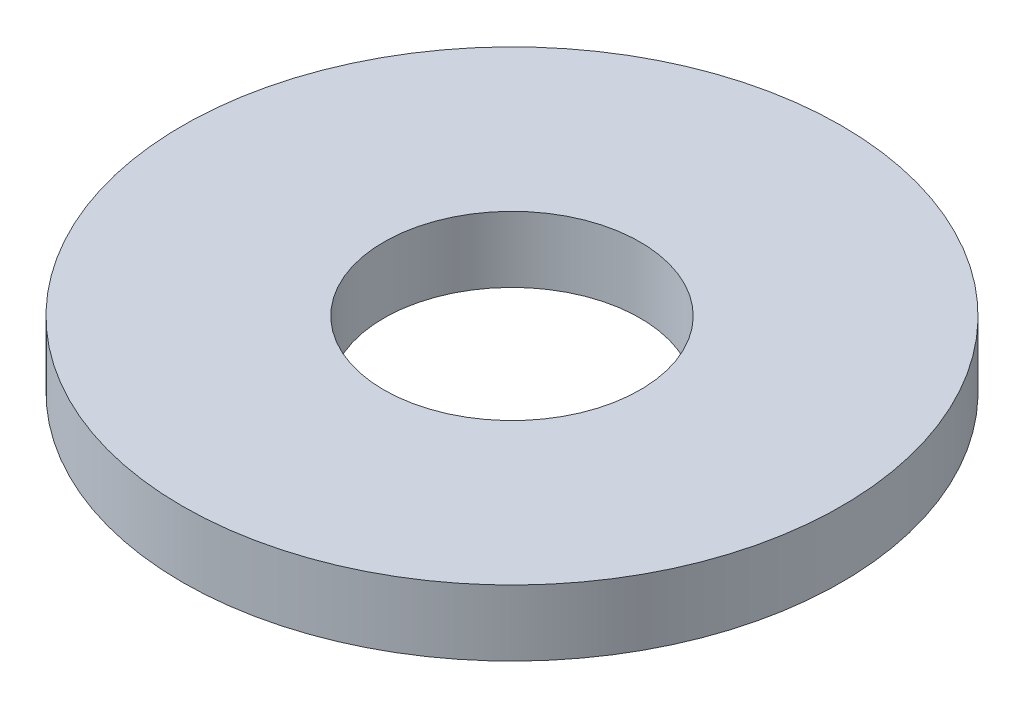
from build123d import *

# Parameters (mm, degrees)
SKETCH1_R           = 45
BOSS_EXTRUDE1_DEPTH = 9
SKETCH2_R           = 17.5
CUT_EXTRUDE1_DEPTH  = 65.272855857


with BuildPart() as part:
    # Sketch1 → Boss-Extrude1 (new body)
    with BuildSketch(Plane(origin=(0, 0, 0), x_dir=(1, 0, 0), z_dir=(0, 1, 0))):
        Circle(SKETCH1_R)
    extrude(amount=BOSS_EXTRUDE1_DEPTH)

    # Sketch2 → Cut-Extrude1 (cut, through all)
    with BuildSketch(Plane(origin=(0, 0, 0), x_dir=(1, 0, 0), z_dir=(0, 1, 0))):
        Circle(SKETCH2_R)
    extrude(amount=CUT_EXTRUDE1_DEPTH, mode=Mode.SUBTRACT)


solid = part.part
